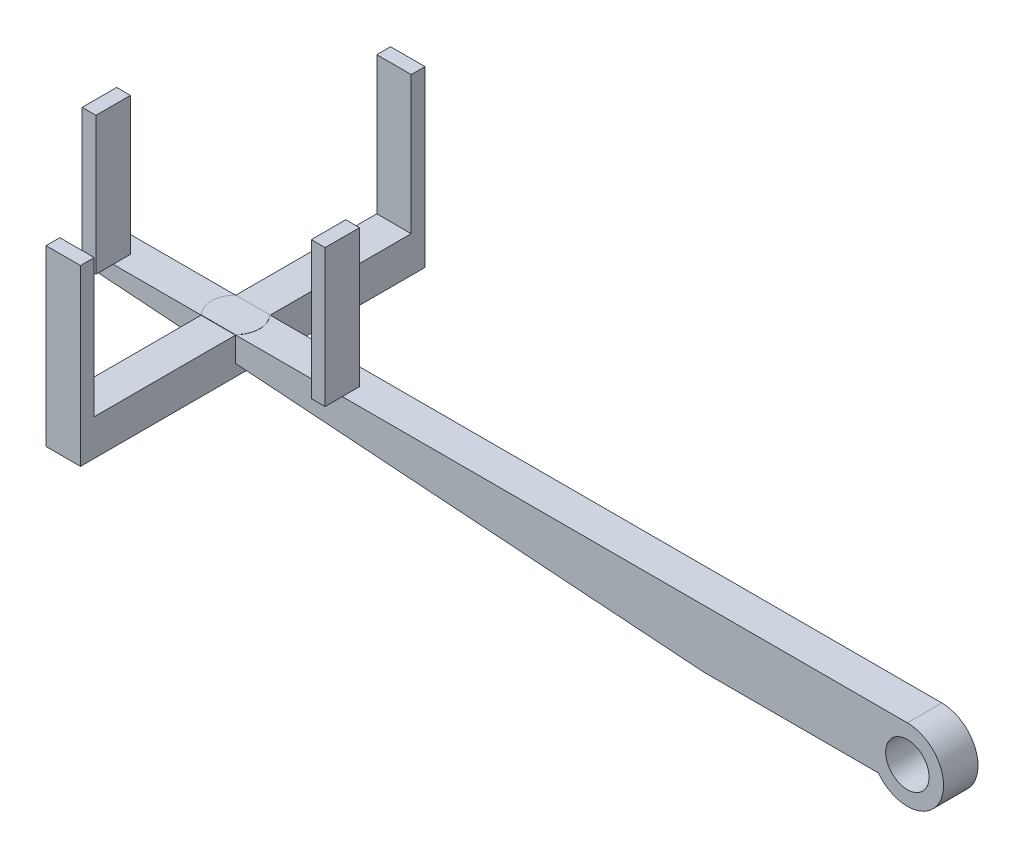
from build123d import *

# Parameters (mm, degrees)
SKETCH1_R             = 6.3
BOSS_EXTRUDE2_DEPTH   = 10
BODY_MOVE_COPY1_ANGLE = 90
BOSS_EXTRUDE4_DEPTH   = 10.5
BOSS_EXTRUDE5_DEPTH   = 0.05
SKETCH5_W             = 4
SKETCH5_H             = 39.958
BOSS_EXTRUDE6_DEPTH   = 10
SKETCH6_W             = 4
SKETCH6_H             = 40
BOSS_EXTRUDE7_DEPTH   = 10


with BuildPart() as part:
    # Sketch1 → Boss-Extrude2 (new body)
    with BuildSketch(Plane.XY):
        with BuildLine():
            Line((10.394563839, -1.484265), (10.5, 0))
            ThreePointArc((10.5, 0), (0, 10.5), (-10.5, 0))
            Line((-10.5, 0), (-10.5, -236.5))
            Line((-10.5, -236.5), (-6.3, -236.5))
            Line((-6.3, -236.5), (6.3, -59.125))
            Line((6.3, -59.125), (6.3, -8.4))
            ThreePointArc((6.3, -8.4), (9.035151526, -5.349395938), (10.394563839, -1.484265))
        make_face()
        Circle(SKETCH1_R, mode=Mode.SUBTRACT)
    extrude(amount=BOSS_EXTRUDE2_DEPTH)


with BuildPart() as part_1:
    # Body-Move/Copy1: moved
    add(part.part.rotate(Axis((-34.8, -34.75, 0), (0, 0, -1)), BODY_MOVE_COPY1_ANGLE))


with BuildPart() as part_2:
    # Body-Move/Copy2: moved
    add(part_1.part.moved(Location((0, 69.6, 0))))

    # Sketch3 → Boss-Extrude4 (add)
    with BuildSketch(Plane(origin=(0, 0, 0), x_dir=(1, 0, 0), z_dir=(0, 1, 0))):
        Polygon((-195.05, -55), (-195.05, -5), (-195.05, 45), (-205.05, 45), (-205.05, -45), (-205.05, -55), align=None)
    extrude(amount=BOSS_EXTRUDE4_DEPTH)

    # Sketch4 → Boss-Extrude5 (add)
    with BuildSketch(Plane(origin=(0, 10.55, 0), x_dir=(1, 0, 0), z_dir=(0, 1, 0))):
        with BuildLine():
            ThreePointArc((-195.151020514, -10), (-193.596595612, -7.711747002), (-193.05, -5))
            ThreePointArc((-193.05, -5), (-193.596595612, -2.288252998), (-195.151020514, 0))
            Line((-195.151020514, 0), (-204.948979486, 0))
            ThreePointArc((-204.948979486, 0), (-207.05, -5), (-204.948979486, -10))
            Line((-204.948979486, -10), (-195.151020514, -10))
        make_face()
    extrude(amount=BOSS_EXTRUDE5_DEPTH)


with BuildPart() as part_3:
    # Body-Move/Copy4: moved
    add(part_2.part.moved(Location((0, 0, -5))))

    # Sketch5 → Boss-Extrude6 (add)
    with BuildSketch(Plane.XY.offset(10)):
        with Locations((-166.05, 30.529)):
            Rectangle(SKETCH5_W, SKETCH5_H)
        with Locations((-232.552850517, 30.529)):
            Rectangle(SKETCH5_W, SKETCH5_H)
    extrude(amount=-BOSS_EXTRUDE6_DEPTH)

    # Sketch6 → Boss-Extrude7 (add)
    with BuildSketch(Plane.ZY.offset(205.05)):
        with Locations((-48, 30.5)):
            Rectangle(SKETCH6_W, SKETCH6_H)
        with Locations((48, 30.5)):
            Rectangle(SKETCH6_W, SKETCH6_H)
    extrude(amount=-BOSS_EXTRUDE7_DEPTH)


solid = part_3.part
